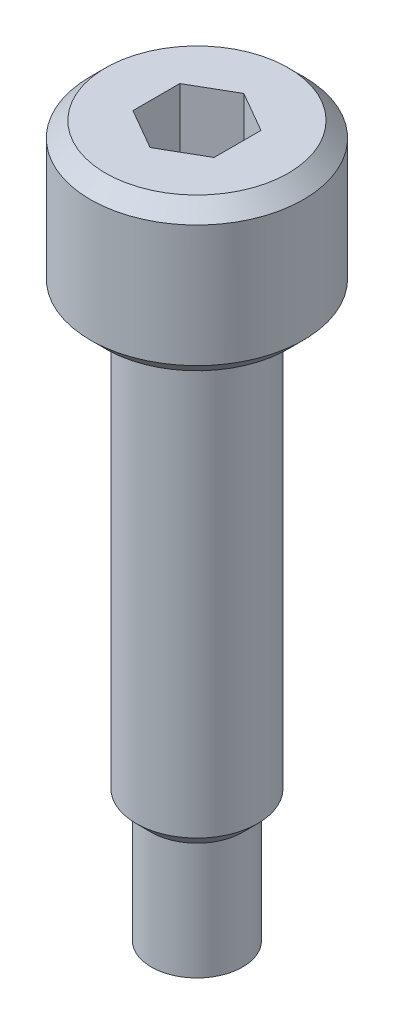
from build123d import *

# Parameters (mm, degrees)
CHAMFER1_SIZE      = 1.5
CUT_EXTRUDE1_DEPTH = 8


with BuildPart() as part:
    # Sketch1 → Revolve1 (revolve)
    with BuildSketch(Plane.XY, mode=Mode.PRIVATE) as revolve1_sk:
        Polygon((0, 0), (4.5, 0), (4.5, 11.5), (6, 11.5), (6, 55), (10.5, 55), (10.5, 70), (0, 70), align=None)
    revolve(revolve1_sk.sketch.rotate(Axis((0, 70, 0), (0, -1, 0)), 180), axis=Axis((0, 70, 0), (0, -1, 0)))

    # Chamfer1
    chamfer1_edges = [part.edges().sort_by_distance(p)[0] for p in [
        (10.5, 70, 0),
        (10.5, 55, 0),
        (6, 11.5, 0),
    ]]
    chamfer(chamfer1_edges, length=CHAMFER1_SIZE - 0.0001)  # a hair under: the kernel refuses the full size

    # Sketch2 → Cut-Extrude1 (cut)
    with BuildSketch(Plane(origin=(0, 70, 0), x_dir=(1, 0, 0), z_dir=(0, 1, 0))):
        Polygon((0, 4.618802154), (-4, 2.309401077), (-4, -2.309401077), (0, -4.618802154), (4, -2.309401077), (4, 2.309401077), align=None)
    extrude(amount=-CUT_EXTRUDE1_DEPTH, mode=Mode.SUBTRACT)


solid = part.part
